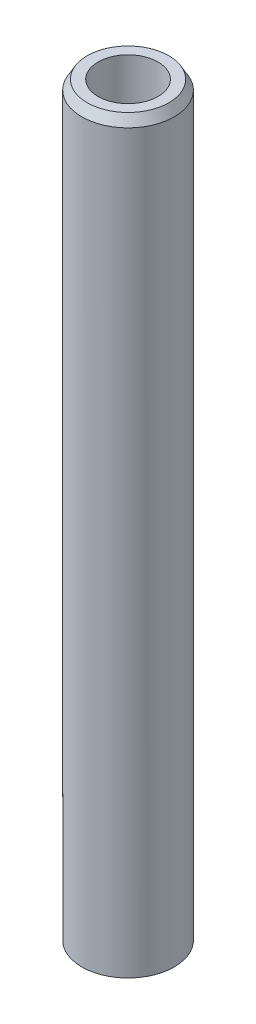
from build123d import *
from OCP.BRepFilletAPI import BRepFilletAPI_MakeChamfer

# Parameters (mm, degrees)
SKETCH1_R           = 15
BOSS_EXTRUDE1_DEPTH = 243.727219642
SKETCH2_R           = 9.722181429
CUT_EXTRUDE1_DEPTH  = 245.648641104
CHAMFER1_SIZE       = 3.070014786
CHAMFER1_SIZE2      = 1.772473863


with BuildPart() as part:
    # Sketch1 → Boss-Extrude1 (new body)
    with BuildSketch(Plane(origin=(0, 0, 0), x_dir=(1, 0, 0), z_dir=(0, 1, 0))):
        Circle(SKETCH1_R)
    extrude(amount=BOSS_EXTRUDE1_DEPTH)

    # Sketch2 → Cut-Extrude1 (cut, through all)
    with BuildSketch(Plane(origin=(0, 0, 0), x_dir=(1, 0, 0), z_dir=(0, 1, 0))):
        Circle(SKETCH2_R)
    extrude(amount=CUT_EXTRUDE1_DEPTH, mode=Mode.SUBTRACT)

    # Chamfer1: one chamfer whose edges measure the first distance from different faces: ONE call of the kernel's chamfer builder (chamfer() names one face for all edges)
    chamfer1_edges_1 = [part.edges().sort_by_distance(p)[0] for p in [
        (-15, 243.727219642, 0),
    ]]
    chamfer1_side_1 = [part.faces().sort_by_distance(p)[0] for p in [
        (-15, 121.863609821, 0),
    ]]
    chamfer1_edges_2 = [part.edges().sort_by_distance(p)[0] for p in [
        (-15, 0, 0),
    ]]
    chamfer1_side_2 = [part.faces().sort_by_distance(p)[0] for p in [
        (-14.575735931, 0, 0),
    ]]
    chamfer1 = BRepFilletAPI_MakeChamfer(part.part.solid().wrapped)
    for e in chamfer1_edges_1:
        chamfer1.Add(CHAMFER1_SIZE, CHAMFER1_SIZE2, e.wrapped, chamfer1_side_1[0].wrapped)  # the first distance lies on this face
    for e in chamfer1_edges_2:
        chamfer1.Add(CHAMFER1_SIZE, CHAMFER1_SIZE2, e.wrapped, chamfer1_side_2[0].wrapped)  # the first distance lies on this face
    add(Compound.cast(chamfer1.Shape()), mode=Mode.REPLACE)


solid = part.part
